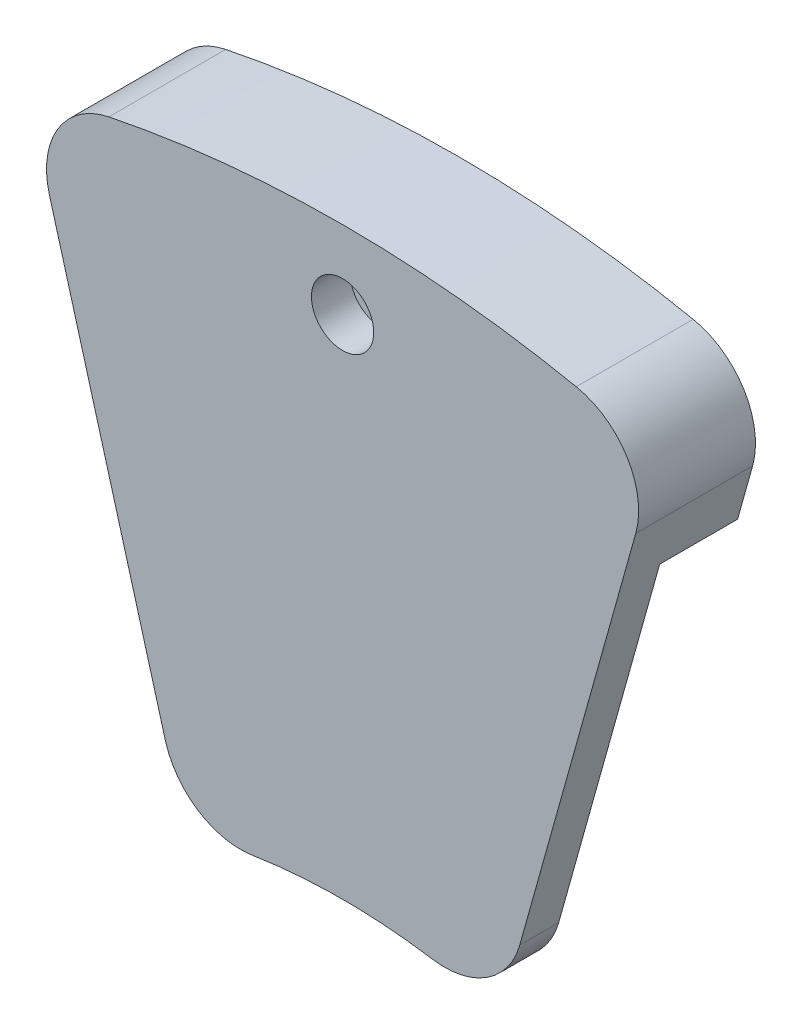
from build123d import *

# Parameters (mm, degrees)
EXTRUDE_1_DEPTH = 5
EXTRUDE_START   = 10
EXTRUDE_2_DEPTH = 10


with BuildPart() as part:
    # 草图1 → 凸台-拉伸1 (new body)
    with BuildSketch(Plane.XY):
        with BuildLine():
            Line((-37.630075072, 134.476679949), (-22.746271228, 81.287189306))
            ThreePointArc((-22.746271228, 81.287189306), (-19.159893018, 76.014894835), (-13.116196156, 73.981934953))
            ThreePointArc((-13.116196156, 73.981934953), (-12.342334545, 74.011923006), (-11.573114255, 74.101707311))
            ThreePointArc((-11.573114255, 74.101707311), (0, 75), (11.573114255, 74.101707311))
            ThreePointArc((11.573114255, 74.101707311), (12.342334545, 74.011923006), (13.116196156, 73.981934953))
            ThreePointArc((13.116196156, 73.981934953), (19.159893018, 76.014894835), (22.746271228, 81.287189306))
            Line((22.746271228, 81.287189306), (37.630075072, 134.476679949))
            ThreePointArc((37.630075072, 134.476679949), (36.534141944, 142.38375917), (30, 146.969384567))
            ThreePointArc((30, 146.969384567), (0, 150), (-30, 146.969384567))
            ThreePointArc((-30, 146.969384567), (-36.534141944, 142.38375917), (-37.630075072, 134.476679949))
        make_face()
        with BuildLine():
            ThreePointArc((0, 144), (-4, 140), (0, 136))
            ThreePointArc((0, 136), (4, 140), (0, 144))
        make_face(mode=Mode.SUBTRACT)
    extrude(amount=EXTRUDE_1_DEPTH)

    # 草图2 → 凸台-拉伸2 (add)
    with BuildSketch(Plane(origin=(0, 0, 0), x_dir=(-1, 0, 0), z_dir=(0, 0, -1)).offset(EXTRUDE_START)):
        with BuildLine():
            Line((37.630075072, 134.476679949), (35.705379823, 127.598494708))
            ThreePointArc((35.705379823, 127.598494708), (0, 132.5), (-35.705379823, 127.598494708))
            Line((-35.705379823, 127.598494708), (-37.630075072, 134.476679949))
            ThreePointArc((-37.630075072, 134.476679949), (-36.534141944, 142.38375917), (-30, 146.969384567))
            ThreePointArc((-30, 146.969384567), (0, 150), (30, 146.969384567))
            ThreePointArc((30, 146.969384567), (36.534141944, 142.38375917), (37.630075072, 134.476679949))
        make_face()
    extrude(amount=-EXTRUDE_2_DEPTH)


solid = part.part
